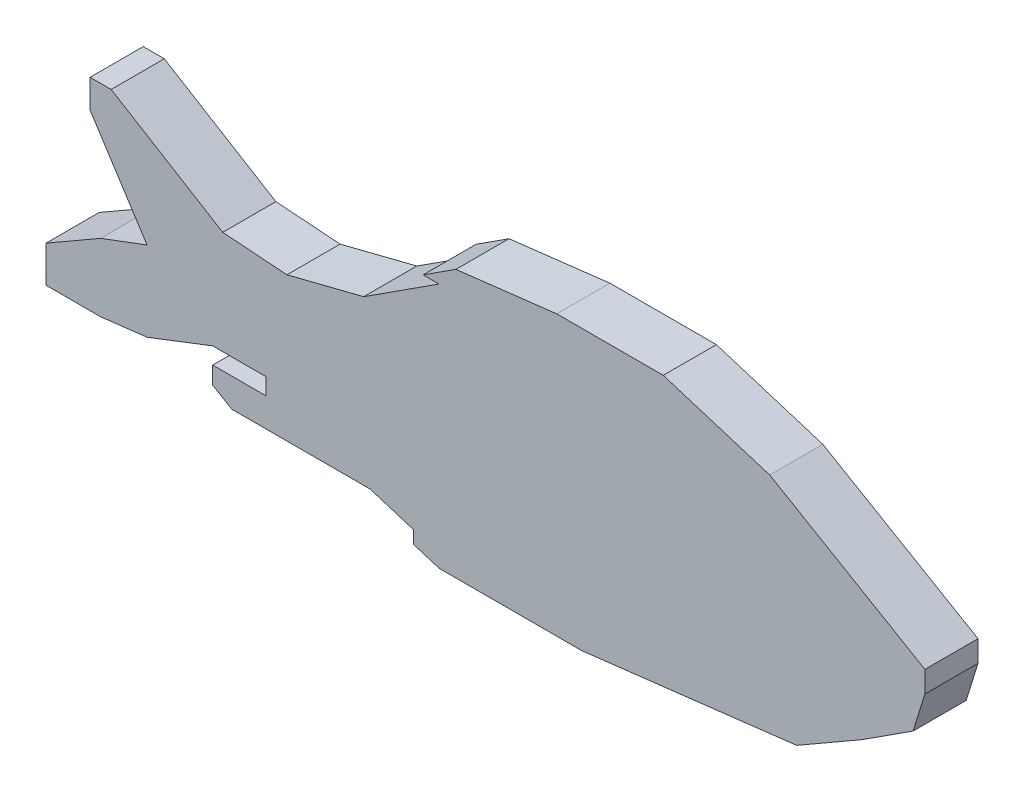
from build123d import *

# Parameters (mm, degrees)
EXTRUDE_1_DEPTH = 10


with BuildPart() as part:
    # Эскиз1 → Бобышка-Вытянуть1 (new body)
    with BuildSketch(Plane.XY):
        Polygon((-69.951928848, 0), (-80.669731272, 16.618074345), (-80.669731272, 21.976975557), (-76.708804289, 21.976975557), (-55.704155573, 9.189080261), (-43.623414196, 8.309037173), (-29.177680493, 11.958160247), (-14.990501589, 21.10816026), (-17.993886659, 21.10816026), (-11.823371849, 25.087824643), (7.169649468, 27.33587677), (27.207280088, 27.33587677), (47.244910708, 21.10816026), (69.1303592, 8.309037173), (76.451316139, 4.027570013), (76.451316139, 0), (74.2292526, -7.149472579), (64.549652508, -13.392316315), (52.322150234, -20.431618657), (37.226095398, -22.218418009), (11.884070144, -25.217950986), (-14.990501589, -25.217950986), (-19.815988887, -23.718184497), (-19.815988887, -21.325018333), (-27.954204926, -18.795652294), (-34.559579547, -18.795652294), (-53.981379219, -18.795652294), (-57.589057076, -16.68579775), (-57.589057076, -13.392316315), (-47.560949575, -13.392316315), (-47.560949575, -10.270894447), (-57.589057076, -10.270894447), (-69.951928848, -15.039057033), (-78.689267781, -16.073226007), (-88.972720777, -16.073226007), (-88.972720777, -9.208714928), (-85.395748333, -7.149472579), (-78.689267781, -3.288590512), align=None)
    extrude(amount=EXTRUDE_1_DEPTH)


solid = part.part
